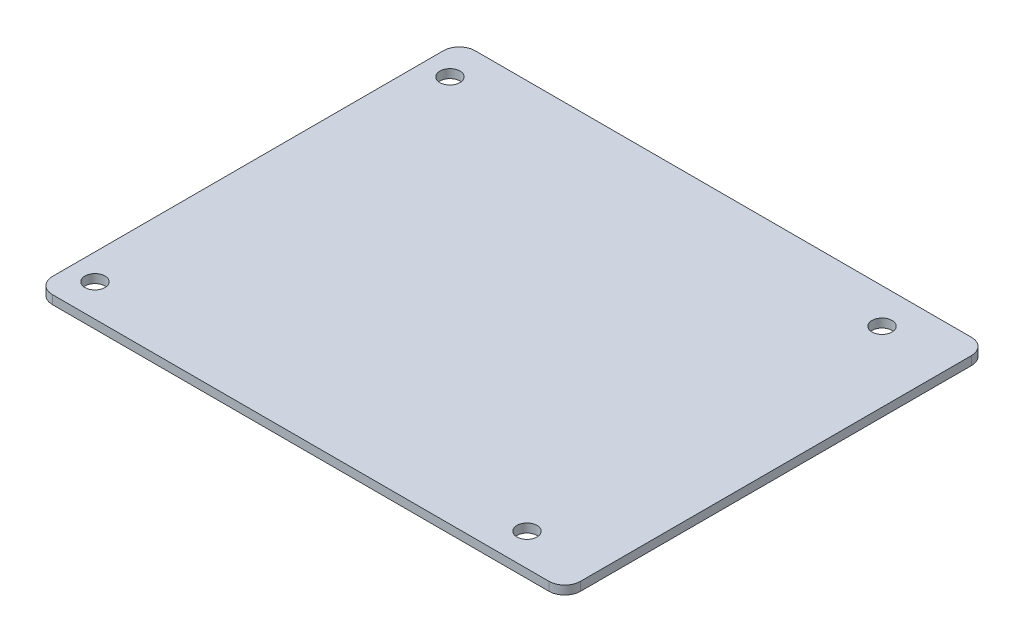
from build123d import *

# Parameters (mm, degrees)
SKETCH1_W           = 100.12
SKETCH1_H           = 80.12
BOSS_EXTRUDE1_DEPTH = 0.825
FILLET1_R           = 3
CUT_EXTRUDE1_REACH  = 66.137
SKETCH2_R           = 1.905


with BuildPart() as part:
    # Sketch1 → Boss-Extrude1 (new, symmetric)
    with BuildSketch(Plane(origin=(0, 0, 0), x_dir=(1, 0, 0), z_dir=(0, 1, 0))):
        Rectangle(SKETCH1_W, SKETCH1_H)
    extrude(amount=BOSS_EXTRUDE1_DEPTH, both=True)

    # Fillet1
    fillet1_edges = [part.edges().sort_by_distance(p)[0] for p in [
        (-50.06, 0, -40.06),
        (50.06, 0, -40.06),
        (50.06, 0, 40.06),
        (-50.06, 0, 40.06),
    ]]
    fillet(fillet1_edges, radius=FILLET1_R)

    # Sketch2 → Cut-Extrude1 (cut, up to next)
    with BuildSketch(Plane(origin=(0, 0.825, 0), x_dir=(1, 0, 0), z_dir=(0, 1, 0)), mode=Mode.PRIVATE) as cut_extrude1_sk1:
        with Locations((-45.155, 33.3925)):
            Circle(SKETCH2_R)
    cut_extrude1_tool1 = extrude(cut_extrude1_sk1.sketch, amount=-CUT_EXTRUDE1_REACH, mode=Mode.PRIVATE) & part.part
    # Sketch2 → Cut-Extrude1 (cut, up to next)
    with BuildSketch(Plane(origin=(0, 0.825, 0), x_dir=(1, 0, 0), z_dir=(0, 1, 0)), mode=Mode.PRIVATE) as cut_extrude1_sk2:
        with Locations((-45.155, -33.9175)):
            Circle(SKETCH2_R)
    cut_extrude1_tool2 = extrude(cut_extrude1_sk2.sketch, amount=-CUT_EXTRUDE1_REACH, mode=Mode.PRIVATE) & part.part
    # Sketch2 → Cut-Extrude1 (cut, up to next)
    with BuildSketch(Plane(origin=(0, 0.825, 0), x_dir=(1, 0, 0), z_dir=(0, 1, 0)), mode=Mode.PRIVATE) as cut_extrude1_sk3:
        with Locations((36.76, -33.9175)):
            Circle(SKETCH2_R)
    cut_extrude1_tool3 = extrude(cut_extrude1_sk3.sketch, amount=-CUT_EXTRUDE1_REACH, mode=Mode.PRIVATE) & part.part
    # Sketch2 → Cut-Extrude1 (cut, up to next)
    with BuildSketch(Plane(origin=(0, 0.825, 0), x_dir=(1, 0, 0), z_dir=(0, 1, 0)), mode=Mode.PRIVATE) as cut_extrude1_sk4:
        with Locations((36.76, 33.3925)):
            Circle(SKETCH2_R)
    cut_extrude1_tool4 = extrude(cut_extrude1_sk4.sketch, amount=-CUT_EXTRUDE1_REACH, mode=Mode.PRIVATE) & part.part
    add(cut_extrude1_tool1.solids().sort_by_distance((-45.155, 0.825, -33.3925))[0], mode=Mode.SUBTRACT)
    add(cut_extrude1_tool2.solids().sort_by_distance((-45.155, 0.825, 33.9175))[0], mode=Mode.SUBTRACT)
    add(cut_extrude1_tool3.solids().sort_by_distance((36.76, 0.825, 33.9175))[0], mode=Mode.SUBTRACT)
    add(cut_extrude1_tool4.solids().sort_by_distance((36.76, 0.825, -33.3925))[0], mode=Mode.SUBTRACT)


solid = part.part
